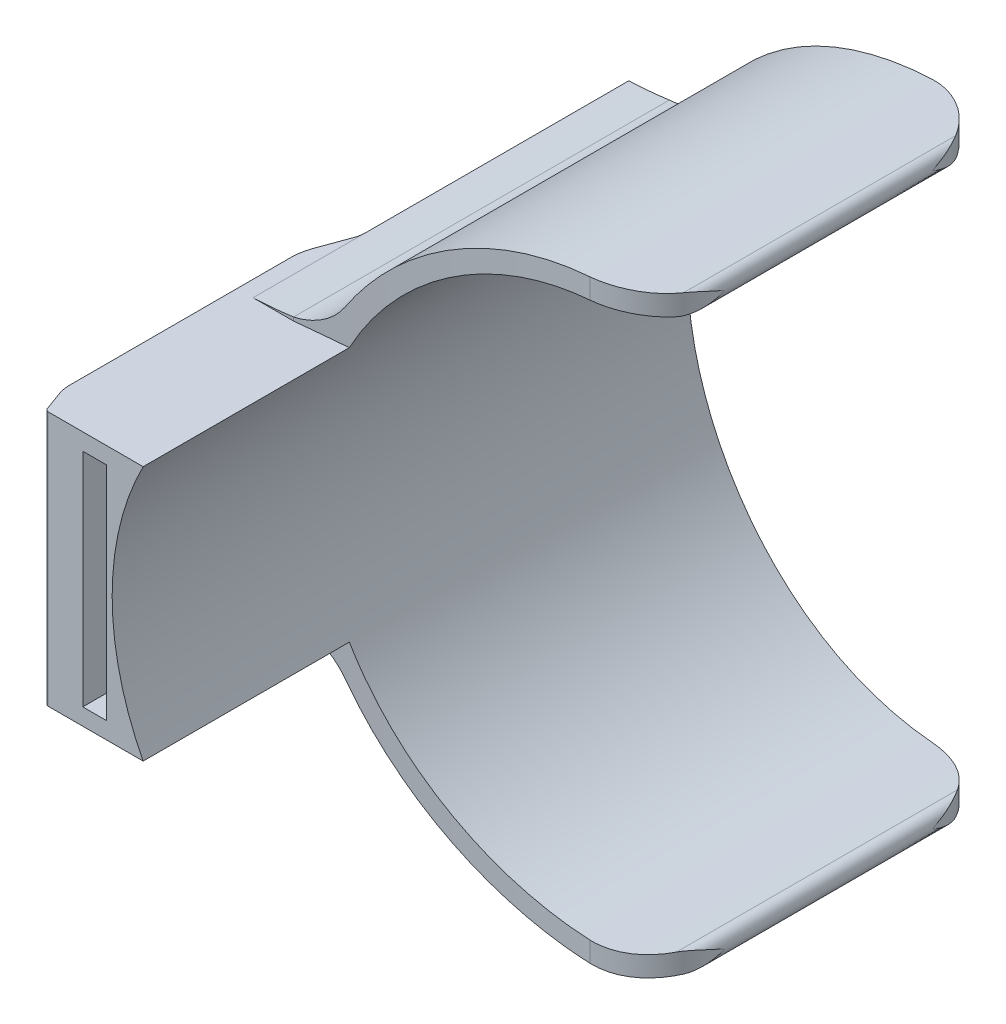
from build123d import *

# Parameters (mm, degrees)
SKETCH3_W           = 9
SKETCH3_H           = 38
BOSS_EXTRUDE1_DEPTH = 28
BOSS_EXTRUDE3_DEPTH = 28
CUT_EXTRUDE1_REACH  = 109.722
BOSS_EXTRUDE4_START = 58
BOSS_EXTRUDE4_DEPTH = 58
CUT_EXTRUDE2_REACH  = 103.055
SKETCH9_W           = 3.54
SKETCH9_H           = 33
CUT_EXTRUDE3_DEPTH  = 57


with BuildPart() as part:
    # Sketch3 → Boss-Extrude1 (new, symmetric)
    with BuildSketch(Plane.XY):
        Rectangle(SKETCH3_W, SKETCH3_H)
    extrude(amount=BOSS_EXTRUDE1_DEPTH, both=True)

    # Sketch4 → Boss-Extrude3 (add, symmetric)
    with BuildSketch(Plane.XY):
        with BuildLine():
            Line((-4.5, 19), (-4.5, -19))
            ThreePointArc((-4.5, -19), (-1.477181068, -19.18738908), (1.532172374, -19.528476784))
            ThreePointArc((1.532172374, -19.528476784), (5.537962676, -21.006521189), (8.562063643, -24.020784707))
            ThreePointArc((8.562063643, -24.020784707), (27.325341478, -40.317029903), (51.907197943, -43.972236504))
            ThreePointArc((51.907197943, -43.972236504), (53.189717224, -42.28251928), (51.5, -41))
            ThreePointArc((51.5, -41), (4.5, 0), (51.5, 41))
            ThreePointArc((51.5, 41), (53.189717224, 42.28251928), (51.907197943, 43.972236504))
            ThreePointArc((51.907197943, 43.972236504), (27.325341478, 40.317029903), (8.562063643, 24.020784707))
            ThreePointArc((8.562063643, 24.020784707), (5.537962676, 21.006521189), (1.532172374, 19.528476784))
            ThreePointArc((1.532172374, 19.528476784), (-1.477181068, 19.18738908), (-4.5, 19))
        make_face()
    extrude(amount=BOSS_EXTRUDE3_DEPTH, both=True)

    # Sketch5 → Cut-Extrude1 (cut, up to next)
    with BuildSketch(Plane(origin=(0, 45, 0), x_dir=(1, 0, 0), z_dir=(0, 1, 0)), mode=Mode.PRIVATE) as cut_extrude1_sk1:
        with BuildLine():
            Line((53.203598972, -28), (53.203598972, -15.5))
            ThreePointArc((53.203598972, -15.5), (50.203598972, -22.5), (43.203598972, -25.5))
            ThreePointArc((43.203598972, -25.5), (22.340717356, -26.297142987), (1.532172374, -28))
            Line((1.532172374, -28), (53.203598972, -28))
        make_face()
    cut_extrude1_tool1 = extrude(cut_extrude1_sk1.sketch, amount=-CUT_EXTRUDE1_REACH, mode=Mode.PRIVATE) & part.part
    # Sketch5 → Cut-Extrude1 (cut, up to next)
    with BuildSketch(Plane(origin=(0, 45, 0), x_dir=(1, 0, 0), z_dir=(0, 1, 0)), mode=Mode.PRIVATE) as cut_extrude1_sk2:
        with BuildLine():
            ThreePointArc((43.203598972, 25.5), (50.172141473, 22.578643748), (53.203598972, 15.657287495))
            Line((53.203598972, 15.657287495), (53.203598972, 28))
            Line((53.203598972, 28), (1.532172374, 28))
            ThreePointArc((1.532172374, 28), (22.340717356, 26.297142987), (43.203598972, 25.5))
        make_face()
    cut_extrude1_tool2 = extrude(cut_extrude1_sk2.sketch, amount=-CUT_EXTRUDE1_REACH, mode=Mode.PRIVATE) & part.part
    add(cut_extrude1_tool1.solids().sort_by_distance((37.070392, 45, 26.213975))[0], mode=Mode.SUBTRACT)
    add(cut_extrude1_tool2.solids().sort_by_distance((37.029308, 45, -26.22765))[0], mode=Mode.SUBTRACT)

    # Sketch7 → Boss-Extrude4 (add)
    with BuildSketch(Plane.XY.offset(BOSS_EXTRUDE4_START)):
        with BuildLine():
            Line((-4.5, 19), (9.119533183, 19))
            ThreePointArc((9.119533183, 19), (4.5, 0), (9.119533183, -19))
            Line((9.119533183, -19), (-4.5, -19))
            Line((-4.5, -19), (-6.880466817, -19))
            Line((-6.880466817, -19), (-6.880466817, 19))
            Line((-6.880466817, 19), (-4.5, 19))
        make_face()
    extrude(amount=-BOSS_EXTRUDE4_DEPTH)

    # Sketch8 → Cut-Extrude2 (cut, up to next)
    with BuildSketch(Plane.XZ.offset(19), mode=Mode.PRIVATE) as cut_extrude2_sk1:
        with BuildLine():
            ThreePointArc((-4.5, 11.294692077), (-4.560768988, 11.989284788), (-4.741229517, 12.66277265))
            Line((-4.741229517, 12.66277265), (-6.398007784, 17.214733527))
            ThreePointArc((-6.398007784, 17.214733527), (-6.758928841, 18.561709253), (-6.880466817, 19.950894674))
            Line((-6.880466817, 19.950894674), (-6.880466817, 0))
            Line((-6.880466817, 0), (-4.5, 0))
            Line((-4.5, 0), (-4.5, 11.294692077))
        make_face()
    cut_extrude2_tool1 = extrude(cut_extrude2_sk1.sketch, amount=-CUT_EXTRUDE2_REACH, mode=Mode.PRIVATE) & part.part
    # Sketch8 → Cut-Extrude2 (cut, up to next)
    with BuildSketch(Plane.XZ.offset(19), mode=Mode.PRIVATE) as cut_extrude2_sk2:
        with BuildLine():
            Line((-6.880466817, 58), (-6.880466817, 53.024116411))
            ThreePointArc((-6.880466817, 53.024116411), (-6.804505582, 53.892357299), (-6.578929921, 54.734217128))
            Line((-6.578929921, 54.734217128), (-5.510024705, 57.671010072))
            ThreePointArc((-5.510024705, 57.671010072), (-5.326966613, 57.909576022), (-5.040178395, 58))
            Line((-5.040178395, 58), (-6.880466817, 58))
        make_face()
    cut_extrude2_tool2 = extrude(cut_extrude2_sk2.sketch, amount=-CUT_EXTRUDE2_REACH, mode=Mode.PRIVATE) & part.part
    add(cut_extrude2_tool1.solids().sort_by_distance((-5.779341, -19, 7.782499))[0], mode=Mode.SUBTRACT)
    add(cut_extrude2_tool2.solids().sort_by_distance((-6.382543, -19, 56.605105))[0], mode=Mode.SUBTRACT)

    # Sketch9 → Cut-Extrude3 (cut)
    with BuildSketch(Plane.XY.offset(58)):
        with Locations((1.889533183, 0)):
            Rectangle(SKETCH9_W, SKETCH9_H)
    extrude(amount=-CUT_EXTRUDE3_DEPTH, mode=Mode.SUBTRACT)


solid = part.part
